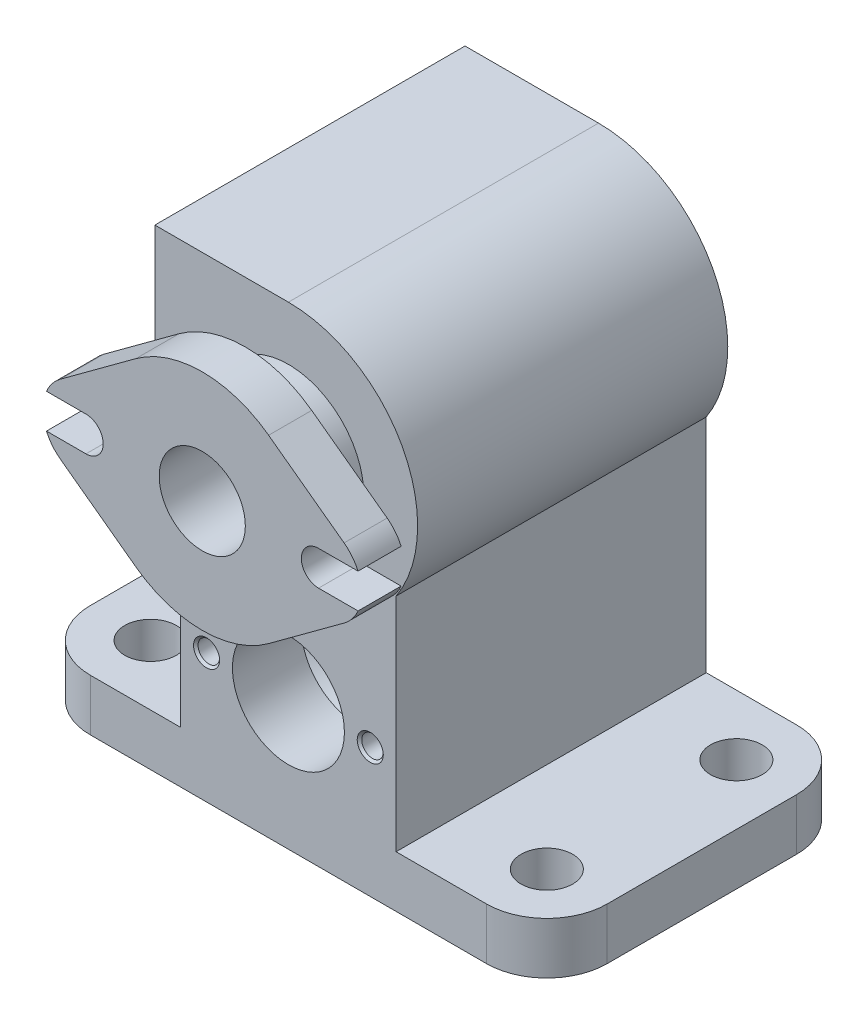
from build123d import *

# Parameters (mm, degrees)
EXTRUDE_1_DEPTH                            = 12
EXTRUDE_1_2_DEPTH                          = 36
EXTRUDE_2_DEPTH                            = 8
EXTRUDE_3_DEPTH                            = 36
EXTRUDE_START                              = 56
EXTRUDE_4_DEPTH                            = 10
SKETCH_6_R                                 = 17.5
EXTRUDE_5_DEPTH                            = 20
CUT_EXTRUDE_1_REACH                        = 157.448
SKETCH_7_R                                 = 10
CUT_EXTRUDE_2_REACH                        = 157.448
HOLE_WIZARD_M16_1_D                        = 14
CUT_EXTRUDE_START                          = 10
CUT_EXTRUDE_3_DEPTH                        = 111.498756211
SKETCH_20_R                                = 6
CUT_EXTRUDE_4_DEPTH                        = 128.82800945
MIRROR_4_AT_THE_SECOND_PLANE_COPY_1_SKET_R = 6
MIRROR_4_AT_THE_SECOND_PLANE_COPY_1_DEPTH  = 128.82800945
CUT_EXTRUDE_5_DEPTH                        = 4


# Read off the part's stored shape, not the designer's step: M5 螺纹孔1
with BuildPart() as part:
    # 草图1 → Extrude 1 (new body)
    with BuildSketch(Plane(origin=(0, 0, 0), x_dir=(1, 0, 0), z_dir=(0, 1, 0))):
        with BuildLine():
            Line((-46, -36), (46, -36))
            ThreePointArc((46, -36), (55.899494937, -31.899494937), (60, -22))
            Line((60, -22), (60, 22))
            ThreePointArc((60, 22), (55.899494937, 31.899494937), (46, 36))
            Line((46, 36), (-46, 36))
            ThreePointArc((-46, 36), (-55.899494937, 31.899494937), (-60, 22))
            Line((-60, 22), (-60, -22))
            ThreePointArc((-60, -22), (-55.899494937, -31.899494937), (-46, -36))
        make_face()
    extrude(amount=EXTRUDE_1_DEPTH)



with BuildPart() as body_2:
    # 草图2 → Extrude 1 2 (new, symmetric)
    with BuildSketch(Plane.XY):
        with BuildLine():
            Line((-31, 102), (0, 102))
            ThreePointArc((0, 102), (22, 80), (0, 58))
            Line((0, 58), (-31, 58))
            Line((-31, 58), (-31, 50))
            Line((-31, 50), (0, 50))
            ThreePointArc((0, 50), (30, 80), (0, 110))
            Line((0, 110), (-31, 110))
            Line((-31, 110), (-31, 102))
        make_face()
    extrude(amount=EXTRUDE_1_2_DEPTH, both=True)

    # 草图3 → 凸台-拉伸2 (add)
    with BuildSketch(Plane.XY.offset(36)):
        with BuildLine():
            Line((-31, 110), (-31, 50))
            Line((-31, 50), (0, 50))
            ThreePointArc((0, 50), (30, 80), (0, 110))
            Line((0, 110), (-31, 110))
        make_face()
    extrude_2 = extrude(amount=-EXTRUDE_2_DEPTH)

    # 镜向1: 凸台-拉伸2 across plane
    add(extrude_2.mirror(Plane.XY))


with BuildPart() as part_1:
    add(part.part)

    add(body_2.part)  # 凸台-拉伸3 merges body 2
    # 草图4 → 凸台-拉伸3 (add, symmetric)
    with BuildSketch(Plane.XY):
        with BuildLine():
            Line((-25, 12), (-25, 50))
            Line((-25, 50), (0, 50))
            ThreePointArc((0, 50), (14.186371655, 53.566179631), (25, 63.416876048))
            Line((25, 63.416876048), (25, 12))
            Line((25, 12), (-25, 12))
        make_face()
    extrude(amount=EXTRUDE_3_DEPTH, both=True)



with BuildPart() as body_2_2:
    # 草图5 → 凸台-拉伸4 (new body)
    with BuildSketch(Plane.XY.offset(EXTRUDE_START)):
        with BuildLine():
            Line((15.407407407, 100.943060831), (32.925925926, 88.055023397))
            ThreePointArc((32.925925926, 88.055023397), (37, 80), (32.925925926, 71.944976603))
            Line((32.925925926, 71.944976603), (15.407407407, 59.056939169))
            ThreePointArc((15.407407407, 59.056939169), (0, 54), (-15.407407407, 59.056939169))
            Line((-15.407407407, 59.056939169), (-32.925925926, 71.944976603))
            ThreePointArc((-32.925925926, 71.944976603), (-37, 80), (-32.925925926, 88.055023397))
            Line((-32.925925926, 88.055023397), (-15.407407407, 100.943060831))
            ThreePointArc((-15.407407407, 100.943060831), (0, 106), (15.407407407, 100.943060831))
        make_face()
    extrude(amount=-EXTRUDE_4_DEPTH)


with BuildPart() as part_2:
    add(part_1.part)

    add(body_2_2.part)  # 凸台-拉伸5 merges body 2 2
    # 草图6 → 凸台-拉伸5 (add)
    with BuildSketch(Plane.XY.offset(56)):
        with Locations(Location((0, 80, 0), (0, 0, 180))):
            Circle(SKETCH_6_R)
    extrude(amount=-EXTRUDE_5_DEPTH)

    # 草图7 → 切除-拉伸1 (cut, up to next)
    with BuildSketch(Plane.XY.offset(56), mode=Mode.PRIVATE) as cut_extrude_1_sk1:
        with Locations((0, 80)):
            Circle(SKETCH_7_R)
    cut_extrude_1_tool1 = extrude(cut_extrude_1_sk1.sketch, amount=-CUT_EXTRUDE_1_REACH, mode=Mode.PRIVATE) & part_2.part
    add(cut_extrude_1_tool1.solids().sort_by_distance((0, 80, 56))[0], mode=Mode.SUBTRACT)

    # 草图8 → 切除-拉伸2 (cut, up to next)
    with BuildSketch(Plane.XY.offset(56), mode=Mode.PRIVATE) as cut_extrude_2_sk1:
        with BuildLine():
            Line((27, 84), (48.849510695, 84))
            ThreePointArc((48.849510695, 84), (52.849510695, 80), (48.849510695, 76))
            Line((48.849510695, 76), (27, 76))
            ThreePointArc((27, 76), (23, 80), (27, 84))
        make_face()
    cut_extrude_2_tool1 = extrude(cut_extrude_2_sk1.sketch, amount=-CUT_EXTRUDE_2_REACH, mode=Mode.PRIVATE) & part_2.part
    cut_extrude_2 = cut_extrude_2_tool1.solids().sort_by_distance((37.924755, 80, 56))[0]
    add(cut_extrude_2, mode=Mode.SUBTRACT)

    # 镜向2: 切除-拉伸2 across plane
    add(cut_extrude_2.mirror(Plane(origin=(0, 0, 0), x_dir=(0, 0, 1), z_dir=(1, 0, 0))), mode=Mode.SUBTRACT)

    # M16 螺纹孔1 (through all)
    with Locations(Plane.XY.offset(56)):
        with Locations((0, 80)):
            Hole(HOLE_WIZARD_M16_1_D / 2)

    # M5 螺纹孔1 outline → M5 螺纹孔1 (revolve, cut)
    with BuildSketch(Plane(origin=(0, 56, 30), x_dir=(0, 1, 0), z_dir=(0, 0, -1))):
        Polygon((2.1, -18.2618073), (0, -17), (0, -31), (2.1, -31), align=None)
    revolve(axis=Axis((0, 56, 30), (1, 0, 0)), mode=Mode.SUBTRACT)

    # Hole Wizard M5 _1 2 outline → Hole Wizard M5 _1 2 (revolve, cut)
    with BuildSketch(Plane(origin=(0, 104, -30), x_dir=(0, 1, 0), z_dir=(0, 0, -1))):
        Polygon((2.1, -18.2618073), (0, -17), (0, -31), (2.1, -31), align=None)
    revolve(axis=Axis((0, 104, -30), (1, 0, 0)), mode=Mode.SUBTRACT)

    # Hole Wizard M5 _1 3 outline → Hole Wizard M5 _1 3 (revolve, cut)
    with BuildSketch(Plane(origin=(0, 56, -30), x_dir=(0, 1, 0), z_dir=(0, 0, -1))):
        Polygon((2.1, -18.2618073), (0, -17), (0, -31), (2.1, -31), align=None)
    revolve(axis=Axis((0, 56, -30), (1, 0, 0)), mode=Mode.SUBTRACT)

    # Hole Wizard M5 _1 4 outline → Hole Wizard M5 _1 4 (revolve, cut)
    with BuildSketch(Plane(origin=(0, 104, 30), x_dir=(0, 1, 0), z_dir=(0, 0, -1))):
        Polygon((2.1, -18.2618073), (0, -17), (0, -31), (2.1, -31), align=None)
    revolve(axis=Axis((0, 104, 30), (1, 0, 0)), mode=Mode.SUBTRACT)

    # 草图15 → 切除-拉伸3 (cut, through all)
    with BuildSketch(Plane(origin=(0, 58, 0), x_dir=(1, 0, 0), z_dir=(0, 1, 0)).offset(CUT_EXTRUDE_START)):
        with BuildLine():
            Line((-6, -6), (-6, 6))
            ThreePointArc((-6, 6), (0, 12), (6, 6))
            Line((6, 6), (6, -6))
            ThreePointArc((6, -6), (0, -12), (-6, -6))
        make_face()
    extrude(amount=-CUT_EXTRUDE_3_DEPTH, mode=Mode.SUBTRACT)

    # 草图17 → 孔1 (revolve, cut)
    with BuildSketch(Plane(origin=(0, 30, 36), x_dir=(0, -1, 0), z_dir=(1, 0, 0))):
        Polygon((0, 0), (0, 60.407745571), (9, 55), (9, 18.403442476), (13, 16), (13, 0), align=None)
    revolve(axis=Axis((0, 30, 42.130023899), (0, 0, -1)), mode=Mode.SUBTRACT)

    # 草图19 → M6 螺纹孔1 (revolve, cut)
    with BuildSketch(Plane(origin=(-19, 30, 36), x_dir=(0, -1, 0), z_dir=(1, 0, 0))):
        Polygon((0, 0), (0, 17.502151548), (2.5, 16), (2.5, 0.525), (3.025, 0), align=None)
    hole_wizard_m6_1 = revolve(axis=Axis((-19, 30, 42.35), (0, 0, -1)), mode=Mode.SUBTRACT)

    # 镜向3: M6 螺纹孔1 across plane
    add(hole_wizard_m6_1.mirror(Plane(origin=(0, 0, 0), x_dir=(0, 0, 1), z_dir=(1, 0, 0))), mode=Mode.SUBTRACT)

    # 草图20 → 切除-拉伸4 (cut, through all)
    with BuildSketch(Plane(origin=(0, 12, 0), x_dir=(1, 0, 0), z_dir=(0, 1, 0))):
        with Locations(Location((-46, 22, 0), (0, 0, 270))):
            Circle(SKETCH_20_R)
    cut_extrude_4 = extrude(amount=-CUT_EXTRUDE_4_DEPTH, mode=Mode.SUBTRACT)

    # 镜向4: 切除-拉伸4 across plane
    add(cut_extrude_4.mirror(Plane(origin=(0, 0, 0), x_dir=(0, 0, 1), z_dir=(1, 0, 0))), mode=Mode.SUBTRACT)

    # 镜向4 at the second plane: 切除-拉伸4 across plane
    add(cut_extrude_4.mirror(Plane.XY), mode=Mode.SUBTRACT)

    # 镜向4 at the second plane copy 1 sket → 镜向4 at the second plane copy 1 (cut, through all)
    with BuildSketch(Plane(origin=(0, 12, 0), x_dir=(-1, 0, 0), z_dir=(0, 1, 0))):
        with Locations(Location((-46, 22, 0), (0, 0, 270))):
            Circle(MIRROR_4_AT_THE_SECOND_PLANE_COPY_1_SKET_R)
    extrude(amount=-MIRROR_4_AT_THE_SECOND_PLANE_COPY_1_DEPTH, mode=Mode.SUBTRACT)

    # 草图21 → 切除-拉伸5 (cut)
    with BuildSketch(Plane.XZ):
        with BuildLine():
            Line((-32.143593539, -24), (32.143593539, -24))
            ThreePointArc((32.143593539, -24), (36.100505063, -12.100505063), (48, -8.143593539))
            Line((48, -8.143593539), (48, 8.143593539))
            ThreePointArc((48, 8.143593539), (36.100505063, 12.100505063), (32.143593539, 24))
            Line((32.143593539, 24), (-32.143593539, 24))
            ThreePointArc((-32.143593539, 24), (-36.100505063, 12.100505063), (-48, 8.143593539))
            Line((-48, 8.143593539), (-48, -8.143593539))
            ThreePointArc((-48, -8.143593539), (-36.100505063, -12.100505063), (-32.143593539, -24))
        make_face()
    extrude(amount=-CUT_EXTRUDE_5_DEPTH, mode=Mode.SUBTRACT)


solid = part_2.part
